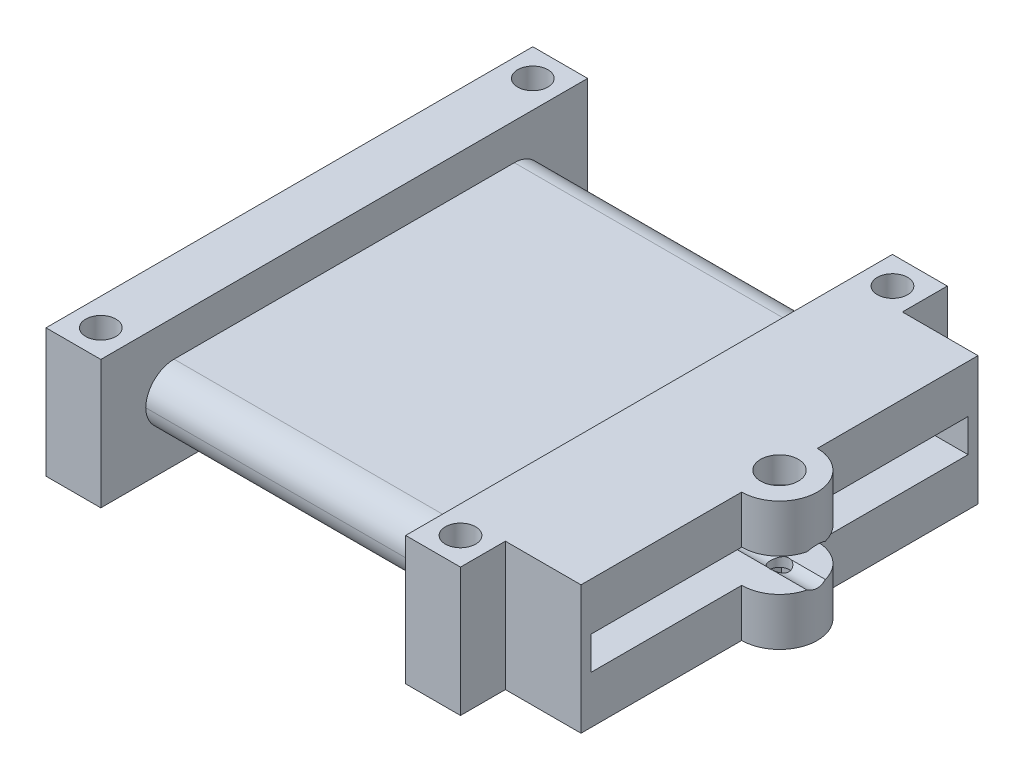
from build123d import *

# Parameters (mm, degrees)
SKETCH1_W           = 42
SKETCH1_H           = 5.9
SKETCH1_W_2         = 39.9
SKETCH1_H_2         = 3.5
BOSS_EXTRUDE1_DEPTH = 32.25
FILLET2_R           = 3
SKETCH2_W           = 51.5
SKETCH2_H           = 13.6
SKETCH2_W_2         = 39.9
SKETCH2_H_2         = 3.5
BOSS_EXTRUDE2_DEPTH = 5.8
SKETCH3_W           = 51.5
SKETCH3_H           = 13.6
SKETCH3_W_2         = 39.9
SKETCH3_H_2         = 3.5
BOSS_EXTRUDE3_DEPTH = 5.8
SKETCH4_R           = 1.6
CUT_EXTRUDE1_DEPTH  = 62.792596644
BOSS_EXTRUDE4_DEPTH = 13.6
CUT_EXTRUDE4_DEPTH  = 4
SKETCH15_W          = 39.9
SKETCH15_H          = 3.5
CUT_EXTRUDE5_DEPTH  = 74.483654645
SKETCH17_R          = 2
CUT_EXTRUDE6_DEPTH  = 74.483654645


with BuildPart() as part:
    # Sketch1 → Boss-Extrude1 (new body)
    with BuildSketch(Plane(origin=(0, 0, 0), x_dir=(0, 0, -1), z_dir=(1, 0, 0))):
        with Locations((21, 2.95)):
            Rectangle(SKETCH1_W, SKETCH1_H)
        with Locations((21, 2.95)):
            Rectangle(SKETCH1_W_2, SKETCH1_H_2, mode=Mode.SUBTRACT)
    extrude(amount=BOSS_EXTRUDE1_DEPTH)

    # Fillet2
    # the kernel refuses this fillet: 3 mm, written as the material it takes off along each edge
    with BuildSketch(Plane(origin=(-7.5, 0, -42), x_dir=(0, 0, 1), z_dir=(1, 0, 0)), Plane(origin=(-7.5, 5.9, 0), x_dir=(0, 0, -1), z_dir=(1, 0, 0)), Plane(origin=(-7.5, 5.9, -42), x_dir=(0, -1, 0), z_dir=(1, 0, 0))) as fillet2_piece_1:
        with BuildLine():
            CenterArc((FILLET2_R, -FILLET2_R), FILLET2_R, 90, 90)
            Line((0, -FILLET2_R), (0, 0))
            Line((0, 0), (FILLET2_R, 0))
        make_face()
    extrude(amount=47.25, mode=Mode.SUBTRACT)
    with BuildSketch(Plane(origin=(-7.5, 0, 0), x_dir=(0, 0, -1), z_dir=(1, 0, 0))) as fillet2_piece_2:
        with BuildLine():
            CenterArc((FILLET2_R, FILLET2_R), FILLET2_R, 180, 90)
            Line((0, FILLET2_R), (0, 0))
            Line((0, 0), (FILLET2_R, 0))
        make_face()
    extrude(amount=47.25, mode=Mode.SUBTRACT)

    # Sketch2 → Boss-Extrude2 (add)
    with BuildSketch(Plane(origin=(32.25, 0, 0), x_dir=(0, 0, -1), z_dir=(1, 0, 0))):
        with Locations((21, 2.95)):
            Rectangle(SKETCH2_W, SKETCH2_H)
        with Locations((21, 2.95)):
            Rectangle(SKETCH2_W_2, SKETCH2_H_2, mode=Mode.SUBTRACT)
    extrude(amount=BOSS_EXTRUDE2_DEPTH)

    # Sketch3 → Boss-Extrude3 (add)
    with BuildSketch(Plane.ZY):
        with Locations((-21, 2.95)):
            Rectangle(SKETCH3_W, SKETCH3_H)
        with Locations((-21, 2.95)):
            Rectangle(SKETCH3_W_2, SKETCH3_H_2, mode=Mode.SUBTRACT)
    extrude(amount=BOSS_EXTRUDE3_DEPTH)

    # Sketch4 → Cut-Extrude1 (cut, through all)
    with BuildSketch(Plane(origin=(0, 9.75, 0), x_dir=(1, 0, 0), z_dir=(0, 1, 0))):
        with Locations(Location((-2.9, 43.85, 0), (0, 0, 270))):
            Circle(SKETCH4_R)
        with Locations(Location((35.15, 43.85, 0), (0, 0, 270))):
            Circle(SKETCH4_R)
        with Locations(Location((-2.9, -1.85, 0), (0, 0, 270))):
            Circle(SKETCH4_R)
        with Locations(Location((35.15, -1.85, 0), (0, 0, 270))):
            Circle(SKETCH4_R)
    extrude(amount=-CUT_EXTRUDE1_DEPTH, mode=Mode.SUBTRACT)

    # Sketch8 → Boss-Extrude4 (add)
    with BuildSketch(Plane(origin=(0, 9.75, 0), x_dir=(1, 0, 0), z_dir=(0, 1, 0))):
        with BuildLine():
            ThreePointArc((46.05, 17), (50.05, 21), (46.05, 25))
            Line((46.05, 25), (46.05, 41.999583304))
            Line((46.05, 41.999583304), (38.05, 41.999583304))
            Line((38.05, 41.999583304), (38.05, 0.000416696))
            Line((38.05, 0.000416696), (46.05, 0.000416696))
            Line((46.05, 0.000416696), (46.05, 17))
        make_face()
    extrude(amount=-BOSS_EXTRUDE4_DEPTH)

    # Sketch13 → CSK for M2 Flat Head Machine Screw1 (revolve, cut)
    with BuildSketch(Plane(origin=(46.05, 9.75, -21), x_dir=(0, 0, 1), z_dir=(1, 0, 0))):
        Polygon((0, 0), (0, 13.6), (1, 13.6), (1, 3.75), (2, 2.75), (2, 0), align=None)
    revolve(axis=Axis((46.05, 16.1, -21), (0, -1, 0)), mode=Mode.SUBTRACT)

    # Sketch14 → Cut-Extrude4 (cut)
    with BuildSketch(Plane.XZ.offset(3.85)):
        Polygon((43.671623782, -20.5274256), (44.451550455, -22.823447025), (46.829926673, -23.296021425), (48.428376218, -21.4725744), (47.648449545, -19.176552975), (45.270073327, -18.703978575), align=None)
    extrude(amount=-CUT_EXTRUDE4_DEPTH, mode=Mode.SUBTRACT)

    # Sketch15 → Cut-Extrude5 (cut, through all)
    with BuildSketch(Plane.ZY.offset(5.8)):
        with Locations((-21, 2.95)):
            Rectangle(SKETCH15_W, SKETCH15_H)
    extrude(amount=-CUT_EXTRUDE5_DEPTH, mode=Mode.SUBTRACT)

    # Sketch17 → Cut-Extrude6 (cut, through all)
    with BuildSketch(Plane.ZY.offset(5.8)):
        with Locations((-21, 2.95)):
            Circle(SKETCH17_R)
    extrude(amount=-CUT_EXTRUDE6_DEPTH, mode=Mode.SUBTRACT)


solid = part.part
